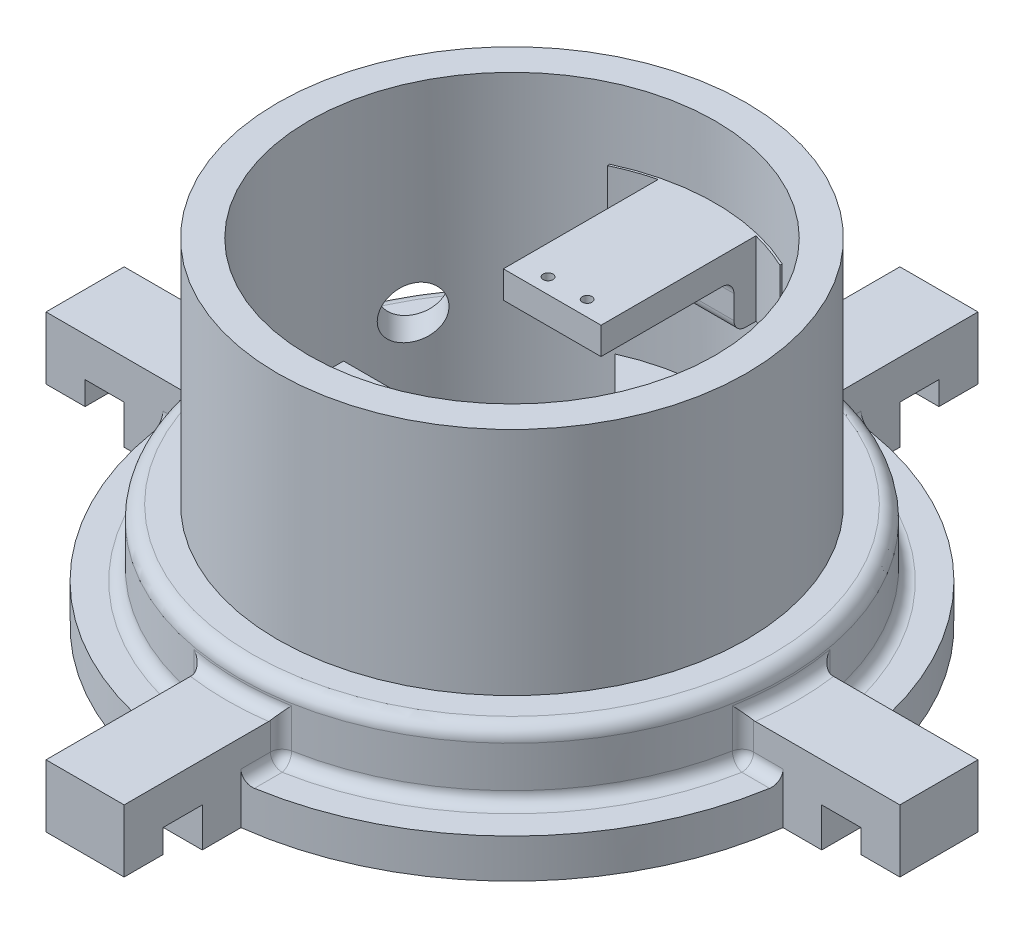
from build123d import *

# Parameters (mm, degrees)
SKETCH1_R                = 70
BOSS_EXTRUDE1_DEPTH      = 80
SKETCH2_R                = 60
CUT_EXTRUDE1_DEPTH       = 90
BOSS_EXTRUDE2_DEPTH      = 20
SKETCH5_R                = 70
BOSS_EXTRUDE3_DEPTH      = 10
SKETCH6_R                = 80
BOSS_EXTRUDE5_DEPTH      = 10
SKETCH7_W                = 20
SKETCH7_H                = 20
BOSS_EXTRUDE6_DEPTH      = 15
CIRPATTERN1_COUNT        = 4
FILLET3_R                = 3
FILLET4_R                = 3
SKETCH11_W               = 20
SKETCH11_H               = 10
CUT_EXTRUDE3_DEPTH       = 10
CIRPATTERN5_COUNT        = 4
SKETCH13_R               = 60
CUT_EXTRUDE4_DEPTH       = 10
BOSS_EXTRUDE7_START      = -6
SKETCH15_R               = 60
BOSS_EXTRUDE7_DEPTH      = 6
SKETCH16_R               = 47.5
CUT_EXTRUDE5_DEPTH       = 3
SKETCH17_R               = 46.5
CUT_EXTRUDE6_DEPTH       = 13
SKETCH18_R               = 60
SKETCH18_R_2             = 46.5
BOSS_EXTRUDE8_DEPTH      = 73
SKETCH19_R               = 70
SKETCH19_R_2             = 60
CUT_EXTRUDE7_DEPTH       = 53
CUT_EXTRUDE8_START       = -53
SKETCH20_R               = 52
SKETCH20_R_2             = 46.5
CUT_EXTRUDE8_DEPTH       = 53
CUT_EXTRUDE9_START       = -13
SKETCH21_R               = 52
SKETCH21_R_2             = 46.5
CUT_EXTRUDE9_DEPTH       = 13
CUT_EXTRUDE10_START      = -7
SKETCH22_R               = 52
SKETCH22_R_2             = 46.5
CUT_EXTRUDE10_DEPTH      = 7
SKETCH24_W               = 13
SKETCH24_H               = 13
CUT_EXTRUDE14_DEPTH      = 38.5
BOSS_EXTRUDE9_REACH      = 175.569
BOSS_EXTRUDE9_END_RADIUS = 52
SKETCH26_W               = 44.158388374
SKETCH26_H               = 30.160471392
BOSS_EXTRUDE10_REACH     = 175.569
SKETCH27_W               = 44.158388374
SKETCH27_H               = 30.160471392
CUT_EXTRUDE15_START      = -11.2
SKETCH28_R               = 52
CUT_EXTRUDE15_DEPTH      = 11.2
SKETCH29_R               = 1.25
CUT_EXTRUDE16_DEPTH      = 169.766007317
SKETCH30_W               = 44.158388374
SKETCH30_H               = 40.9
CUT_EXTRUDE17_DEPTH      = 169.766007317
CUT_EXTRUDE18_DEPTH      = 41.2
CUT_EXTRUDE19_DEPTH      = 56
CUT_EXTRUDE19_DEPTH_BACK = 34
SKETCH34_W               = 25
SKETCH34_H               = 12
FILLET5_R                = 3
BOSS_EXTRUDE11_DEPTH     = 7
CIRPATTERN6_COUNT        = 2
SKETCH37_W               = 10
SKETCH37_H               = 20
CUT_EXTRUDE20_DEPTH      = 4
CIRPATTERN7_COUNT        = 4
SKETCH38_R               = 6.5
CUT_EXTRUDE21_DEPTH      = 30
FILLET6_R                = 3.5
SKETCH40_R               = 72.5
SKETCH40_R_2             = 55
CUT_EXTRUDE22_DEPTH      = 6
SKETCH41_R               = 60
SKETCH41_R_2             = 52
BOSS_EXTRUDE12_DEPTH     = 7


with BuildPart() as part:
    # Sketch1 → Boss-Extrude1 (new body)
    with BuildSketch(Plane(origin=(0, 0, 0), x_dir=(1, 0, 0), z_dir=(0, 1, 0))):
        with Locations(Location((0, 0, 0), (0, 0, 270))):
            Circle(SKETCH1_R)
    extrude(amount=BOSS_EXTRUDE1_DEPTH)

    # Sketch2 → Cut-Extrude1 (cut)
    with BuildSketch(Plane(origin=(0, 80, 0), x_dir=(1, 0, 0), z_dir=(0, 1, 0))):
        with Locations(Location((0, 0, 0), (0, 0, 270))):
            Circle(SKETCH2_R)
    extrude(amount=-CUT_EXTRUDE1_DEPTH, mode=Mode.SUBTRACT)

    # Sketch3 → Boss-Extrude2 (add)
    with BuildSketch(Plane.XZ):
        with BuildLine():
            Line((94.282032303, 10), (94.282032303, -10))
            Line((94.282032303, -10), (69.282032303, -10))
            ThreePointArc((69.282032303, -10), (70, 0), (69.282032303, 10))
            Line((69.282032303, 10), (94.282032303, 10))
        make_face()
        with BuildLine():
            Line((10, -94.282032303), (10, -69.282032303))
            ThreePointArc((10, -69.282032303), (0, -70), (-10, -69.282032303))
            Line((-10, -69.282032303), (-10, -94.282032303))
            Line((-10, -94.282032303), (10, -94.282032303))
        make_face()
        with BuildLine():
            Line((-94.282032303, -10), (-69.282032303, -10))
            ThreePointArc((-69.282032303, -10), (-70, 0), (-69.282032303, 10))
            Line((-69.282032303, 10), (-94.282032303, 10))
            Line((-94.282032303, 10), (-94.282032303, -10))
        make_face()
        with BuildLine():
            Line((-10, 94.282032303), (-10, 69.282032303))
            ThreePointArc((-10, 69.282032303), (0, 70), (10, 69.282032303))
            Line((10, 69.282032303), (10, 94.282032303))
            Line((10, 94.282032303), (-10, 94.282032303))
        make_face()
    extrude(amount=-BOSS_EXTRUDE2_DEPTH)

    # Sketch5 → Boss-Extrude3 (add)
    with BuildSketch(Plane.XZ):
        with Locations(Location((0, 0, 0), (0, 0, 278.213210702))):
            Circle(SKETCH5_R)
    extrude(amount=-BOSS_EXTRUDE3_DEPTH)

    # Sketch6 → Boss-Extrude5 (add)
    with BuildSketch(Plane.XZ):
        Circle(SKETCH6_R)
    extrude(amount=-BOSS_EXTRUDE5_DEPTH)

    # Sketch7 → Boss-Extrude6 (add)
    with BuildSketch(Plane.XY.offset(94.282032303)):
        with Locations((0, 10)):
            Rectangle(SKETCH7_W, SKETCH7_H)
    boss_extrude6 = extrude(amount=BOSS_EXTRUDE6_DEPTH)

    # CirPattern1: Boss-Extrude6 ×4 about axis
    cirpattern1_axis = Axis((0, 0, 0), (0, 1, 0))
    for i in range(1, CIRPATTERN1_COUNT):
        add(boss_extrude6.rotate(cirpattern1_axis, i * 360 / CIRPATTERN1_COUNT))

    # Fillet3
    fillet3_edges = [part.edges().sort_by_distance(p)[0] for p in [
        (69.282032303, 15, 10),
        (70, 20, 0),
        (69.282032303, 15, -10),
        (0, 20, -70),
        (-10, 15, -69.282032303),
        (10, 15, -69.282032303),
        (-70, 20, 0),
        (-69.282032303, 15, 10),
        (-69.282032303, 15, -10),
        (5.012870376, 20, 69.82027736),
        (10, 15, 69.282032303),
        (-10, 15, 69.282032303),
    ]]
    fillet(fillet3_edges, radius=FILLET3_R)

    # Fillet4
    fillet4_edges = [part.edges().sort_by_distance(p)[0] for p in [
        (10, 10, 75.602839658),
        (-10, 10, -75.602839658),
        (-75.602839658, 10, 10),
        (49.497474683, 10, -49.497474683),
        (-49.497474683, 10, -49.497474683),
        (-49.497474683, 10, 49.497474683),
        (49.497474683, 10, 49.497474683),
        (-75.602839658, 10, -10),
        (-69.90995769, 10, -10.697529617),
        (-10.697529617, 10, -69.90995769),
        (10, 10, -75.602839658),
        (69.90995769, 10, -10.697529617),
        (10.697529617, 10, -69.90995769),
        (75.602839658, 10, 10),
        (10.697529617, 10, 69.90995769),
        (69.90995769, 10, 10.697529617),
        (-10, 10, 75.602839658),
        (-69.90995769, 10, 10.697529617),
        (-10.697529617, 10, 69.90995769),
        (75.602839658, 10, -10),
    ]]
    fillet(fillet4_edges, radius=FILLET4_R)

    # Sketch11 → Cut-Extrude3 (cut)
    with BuildSketch(Plane.XZ):
        with Locations((0, -94.282032303)):
            Rectangle(SKETCH11_W, SKETCH11_H)
    cut_extrude3 = extrude(amount=-CUT_EXTRUDE3_DEPTH, mode=Mode.SUBTRACT)

    # CirPattern5: Cut-Extrude3 ×4 about axis
    cirpattern5_axis = Axis((0, 0, 0), (0, 1, 0))
    for i in range(1, CIRPATTERN5_COUNT):
        add(cut_extrude3.rotate(cirpattern5_axis, i * 360 / CIRPATTERN5_COUNT), mode=Mode.SUBTRACT)

    # Sketch13 → Cut-Extrude4 (cut)
    with BuildSketch(Plane(origin=(0, 10, 0), x_dir=(1, 0, 0), z_dir=(0, 1, 0))):
        with Locations(Location((0, 0, 0), (0, 0, 270))):
            Circle(SKETCH13_R)
    extrude(amount=-CUT_EXTRUDE4_DEPTH, mode=Mode.SUBTRACT)

    # Sketch15 → Boss-Extrude7 (add)
    with BuildSketch(Plane.XZ.offset(BOSS_EXTRUDE7_START)):
        with Locations(Location((0, 0, 0), (0, 0, 90))):
            Circle(SKETCH15_R)
    extrude(amount=BOSS_EXTRUDE7_DEPTH)

    # Sketch16 → Cut-Extrude5 (cut)
    with BuildSketch(Plane.XZ):
        with Locations(Location((0, 0, 0), (0, 0, 270))):
            Circle(SKETCH16_R)
    extrude(amount=-CUT_EXTRUDE5_DEPTH, mode=Mode.SUBTRACT)

    # Sketch17 → Cut-Extrude6 (cut)
    with BuildSketch(Plane.XZ.offset(-3)):
        with Locations(Location((0, 0, 0), (0, 0, 270))):
            Circle(SKETCH17_R)
    extrude(amount=-CUT_EXTRUDE6_DEPTH, mode=Mode.SUBTRACT)

    # Sketch18 → Boss-Extrude8 (add)
    with BuildSketch(Plane(origin=(0, 6, 0), x_dir=(1, 0, 0), z_dir=(0, 1, 0))):
        with Locations(Location((0, 0, 0), (0, 0, 270))):
            Circle(SKETCH18_R)
        with Locations(Location((0, 0, 0), (0, 0, 90))):
            Circle(SKETCH18_R_2, mode=Mode.SUBTRACT)
    extrude(amount=BOSS_EXTRUDE8_DEPTH)

    # Sketch19 → Cut-Extrude7 (cut)
    with BuildSketch(Plane(origin=(0, 80, 0), x_dir=(1, 0, 0), z_dir=(0, 1, 0))):
        with Locations(Location((0, 0, 0), (0, 0, 79.741927215))):
            Circle(SKETCH19_R)
        with Locations(Location((0, 0, 0), (0, 0, 270))):
            Circle(SKETCH19_R_2, mode=Mode.SUBTRACT)
    extrude(amount=-CUT_EXTRUDE7_DEPTH, mode=Mode.SUBTRACT)

    # Sketch20 → Cut-Extrude8 (cut)
    with BuildSketch(Plane(origin=(0, 79, 0), x_dir=(1, 0, 0), z_dir=(0, 1, 0)).offset(CUT_EXTRUDE8_START)):
        with Locations(Location((0, 0, 0), (0, 0, 270))):
            Circle(SKETCH20_R)
        with Locations(Location((0, 0, 0), (0, 0, 90))):
            Circle(SKETCH20_R_2, mode=Mode.SUBTRACT)
    extrude(amount=CUT_EXTRUDE8_DEPTH, mode=Mode.SUBTRACT)

    # Sketch21 → Cut-Extrude9 (cut)
    with BuildSketch(Plane(origin=(0, 26, 0), x_dir=(1, 0, 0), z_dir=(0, 1, 0)).offset(CUT_EXTRUDE9_START)):
        with Locations(Location((0, 0, 0), (0, 0, 270))):
            Circle(SKETCH21_R)
        with Locations(Location((0, 0, 0), (0, 0, 90))):
            Circle(SKETCH21_R_2, mode=Mode.SUBTRACT)
    extrude(amount=CUT_EXTRUDE9_DEPTH, mode=Mode.SUBTRACT)

    # Sketch22 → Cut-Extrude10 (cut)
    with BuildSketch(Plane(origin=(0, 13, 0), x_dir=(1, 0, 0), z_dir=(0, 1, 0)).offset(CUT_EXTRUDE10_START)):
        with Locations(Location((0, 0, 0), (0, 0, 270))):
            Circle(SKETCH22_R)
        with Locations(Location((0, 0, 0), (0, 0, 90))):
            Circle(SKETCH22_R_2, mode=Mode.SUBTRACT)
    extrude(amount=CUT_EXTRUDE10_DEPTH, mode=Mode.SUBTRACT)

    # Sketch24 → Cut-Extrude14 (cut, symmetric)
    with BuildSketch(Plane(origin=(-44.686269666, 0, -44.686269666), x_dir=(-0.707106781186544, 0, 0.7071067811865511), z_dir=(-0.7071067811865511, 0, -0.707106781186544))):
        with Locations((-25.148919584, 19.5)):
            Rectangle(SKETCH24_W, SKETCH24_H)
    extrude(amount=CUT_EXTRUDE14_DEPTH, both=True, mode=Mode.SUBTRACT)

    # Boss-Extrude9: up to this cylinder (the profile starts inside it)
    boss_extrude9_end = Plane(origin=(0, 63.919764, 0), z_dir=(0, 1, 0)) * Cylinder(BOSS_EXTRUDE9_END_RADIUS, 456.138, mode=Mode.PRIVATE)
    # Sketch26 → Boss-Extrude9 (add, up to the surface)
    with BuildSketch(Plane.XY, mode=Mode.PRIVATE) as boss_extrude9_sk1:
        with Locations((0, 63.919764304)):
            Rectangle(SKETCH26_W, SKETCH26_H)
    boss_extrude9_tool1 = extrude(boss_extrude9_sk1.sketch, amount=-BOSS_EXTRUDE9_REACH, mode=Mode.PRIVATE) & boss_extrude9_end
    add(boss_extrude9_tool1.solids().sort_by_distance((0, 63.919764, 0))[0])

    # Sketch27 → Boss-Extrude10 (add, up to next)
    with BuildSketch(Plane.XY, mode=Mode.PRIVATE) as boss_extrude10_sk1:
        with Locations((0, 63.919764304)):
            Rectangle(SKETCH27_W, SKETCH27_H)
    boss_extrude10_tool1 = extrude(boss_extrude10_sk1.sketch, amount=BOSS_EXTRUDE10_REACH, mode=Mode.PRIVATE) - part.part
    add(boss_extrude10_tool1.solids().sort_by_distance((0, 63.919764, 0))[0])

    # Sketch28 → Cut-Extrude15 (cut)
    with BuildSketch(Plane(origin=(0, 79, 0), x_dir=(1, 0, 0), z_dir=(0, 1, 0)).offset(CUT_EXTRUDE15_START)):
        with Locations(Location((0, 0, 0), (0, 0, 270))):
            Circle(SKETCH28_R)
    extrude(amount=CUT_EXTRUDE15_DEPTH, mode=Mode.SUBTRACT)

    # Sketch29 → Cut-Extrude16 (cut, through all)
    with BuildSketch(Plane(origin=(0, 67.8, 0), x_dir=(1, 0, 0), z_dir=(0, 1, 0))):
        with Locations(Location((-5, 14.23, 0), (0, 0, 270))):
            Circle(SKETCH29_R)
        with Locations(Location((5, 14.23, 0), (0, 0, 270))):
            Circle(SKETCH29_R)
        with Locations(Location((-5, -34.55, 0), (0, 0, 270))):
            Circle(SKETCH29_R)
        with Locations(Location((5, -34.55, 0), (0, 0, 270))):
            Circle(SKETCH29_R)
    extrude(amount=-CUT_EXTRUDE16_DEPTH, mode=Mode.SUBTRACT)

    # Sketch30 → Cut-Extrude17 (cut, through all)
    with BuildSketch(Plane(origin=(0, 67.8, 0), x_dir=(1, 0, 0), z_dir=(0, 1, 0))):
        with Locations((0, -10.16)):
            Rectangle(SKETCH30_W, SKETCH30_H)
    extrude(amount=-CUT_EXTRUDE17_DEPTH, mode=Mode.SUBTRACT)

    # Sketch32 → Cut-Extrude18 (cut)
    with BuildSketch(Plane(origin=(0, 67.8, 0), x_dir=(1, 0, 0), z_dir=(0, 1, 0))):
        with BuildLine():
            Line((12.5, 49.925350828), (12.5, -49.925350828))
            ThreePointArc((12.5, -49.925350828), (51.46640317, 0), (12.5, 49.925350828))
        make_face()
        with BuildLine():
            Line((-12.5, 49.925350828), (-12.5, -49.925350828))
            ThreePointArc((-12.5, -49.925350828), (-51.46640317, 0), (-12.5, 49.925350828))
        make_face()
    extrude(amount=-CUT_EXTRUDE18_DEPTH, mode=Mode.SUBTRACT)

    # Sketch34 → Cut-Extrude19 (cut, two sides: drawn at the far end of the back side and taken through both)
    with BuildSketch(Plane.XY.offset(-10.29).offset(-CUT_EXTRUDE19_DEPTH_BACK)):
        with Locations((0, 54.839528608)):
            Rectangle(SKETCH34_W, SKETCH34_H)
    extrude(amount=CUT_EXTRUDE19_DEPTH + CUT_EXTRUDE19_DEPTH_BACK, mode=Mode.SUBTRACT)

    # Fillet5
    fillet5_edges = [part.edges().sort_by_distance(p)[0] for p in [
        (0, 60.839528608, -44.29),
        (0, 48.839528608, -44.29),
        (0, 60.839528608, 45.71),
        (0, 48.839528608, 45.71),
    ]]
    fillet(fillet5_edges, radius=FILLET5_R)

    # Sketch36 → Boss-Extrude11 (add)
    with BuildSketch(Plane(origin=(0, 6, 0), x_dir=(1, 0, 0), z_dir=(0, 1, 0))):
        with BuildLine():
            Line((41.126578864, 23.783704499), (44.825748305, 26.35625711))
            ThreePointArc((44.825748305, 26.35625711), (42.692785655, 29.687136154), (40.312819269, 32.846257056))
            Line((40.312819269, 32.846257056), (35.920934884, 29.798262316))
            Line((35.920934884, 29.798262316), (29.222043416, 25.149190488))
            Line((29.222043416, 25.149190488), (33.741794506, 18.64892868))
            Line((33.741794506, 18.64892868), (41.126578864, 23.783704499))
        make_face()
    boss_extrude11 = extrude(amount=BOSS_EXTRUDE11_DEPTH)

    # CirPattern6: Boss-Extrude11 ×2 about axis
    cirpattern6_axis = Axis((0, 0, 0), (0, 1, 0))
    for i in range(1, CIRPATTERN6_COUNT):
        add(boss_extrude11.rotate(cirpattern6_axis, i * 360 / CIRPATTERN6_COUNT))

    # Sketch37 → Cut-Extrude20 (cut)
    with BuildSketch(Plane.XZ):
        with Locations((-104.282032303, 0)):
            Rectangle(SKETCH37_W, SKETCH37_H)
    cut_extrude20 = extrude(amount=-CUT_EXTRUDE20_DEPTH, mode=Mode.SUBTRACT)

    # CirPattern7: Cut-Extrude20 ×4 about axis
    cirpattern7_axis = Axis((0, 26, 0), (0, 1, 0))
    for i in range(1, CIRPATTERN7_COUNT):
        add(cut_extrude20.rotate(cirpattern7_axis, i * 360 / CIRPATTERN7_COUNT), mode=Mode.SUBTRACT)

    # Sketch38 → Cut-Extrude21 (cut)
    with BuildSketch(Plane(origin=(-44.686269666, 0, -44.686269666), x_dir=(-0.707106781186544, 0, 0.7071067811865511), z_dir=(-0.7071067811865511, 0, -0.707106781186544))):
        with Locations((17.896012789, 35.015032818)):
            Circle(SKETCH38_R)
    extrude(amount=-CUT_EXTRUDE21_DEPTH, mode=Mode.SUBTRACT)

    # Fillet6
    # the kernel refuses this fillet: 3.5 mm, written as the material it takes off along each edge
    with BuildSketch(Plane(origin=(0, 27, 0), x_dir=(0, 0, 1), z_dir=(1, 0, 0))) as fillet6_piece_1:
        with BuildLine():
            CenterArc((70 - FILLET6_R, FILLET6_R), FILLET6_R, 270, 90)
            Line((70 - FILLET6_R, 0), (70, 0))
            Line((70, 0), (70, FILLET6_R))
        make_face()
    revolve(axis=Axis((0, 27, 0), (0, -1, 0)), mode=Mode.SUBTRACT)

    # Sketch40 → Cut-Extrude22 (cut)
    with BuildSketch(Plane.XZ):
        with Locations(Location((0, 0, 0), (0, 0, 270))):
            Circle(SKETCH40_R)
        with Locations(Location((0, 0, 0), (0, 0, 270))):
            Circle(SKETCH40_R_2, mode=Mode.SUBTRACT)
    extrude(amount=-CUT_EXTRUDE22_DEPTH, mode=Mode.SUBTRACT)

    # Sketch41 → Boss-Extrude12 (add)
    with BuildSketch(Plane(origin=(0, 79, 0), x_dir=(1, 0, 0), z_dir=(0, 1, 0))):
        with Locations(Location((0, 0, 0), (0, 0, 270))):
            Circle(SKETCH41_R)
        with Locations(Location((0, 0, 0), (0, 0, 270))):
            Circle(SKETCH41_R_2, mode=Mode.SUBTRACT)
    extrude(amount=BOSS_EXTRUDE12_DEPTH)


solid = part.part
